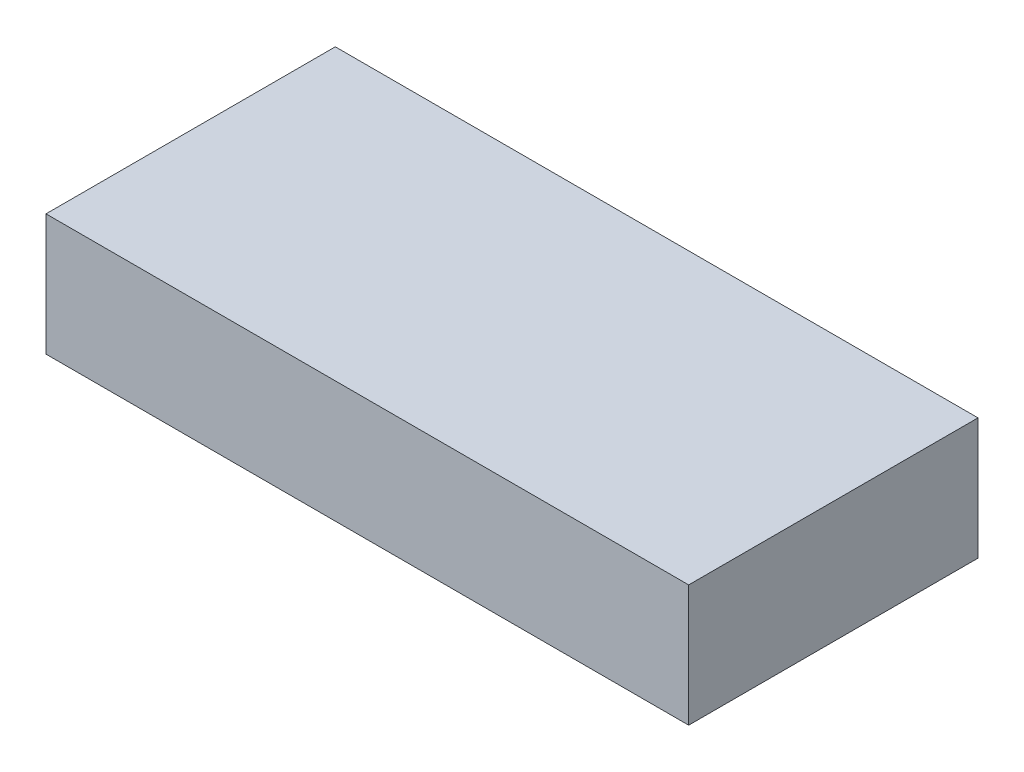
from build123d import *

# Parameters (mm, degrees)
SKETCH2_W           = 22.214358562
SKETCH2_H           = 4.2
BOSS_EXTRUDE1_DEPTH = 10


with BuildPart() as part:
    # Sketch2 → Boss-Extrude1 (new body)
    with BuildSketch(Plane.XY):
        Rectangle(SKETCH2_W, SKETCH2_H)
    extrude(amount=BOSS_EXTRUDE1_DEPTH)


solid = part.part
